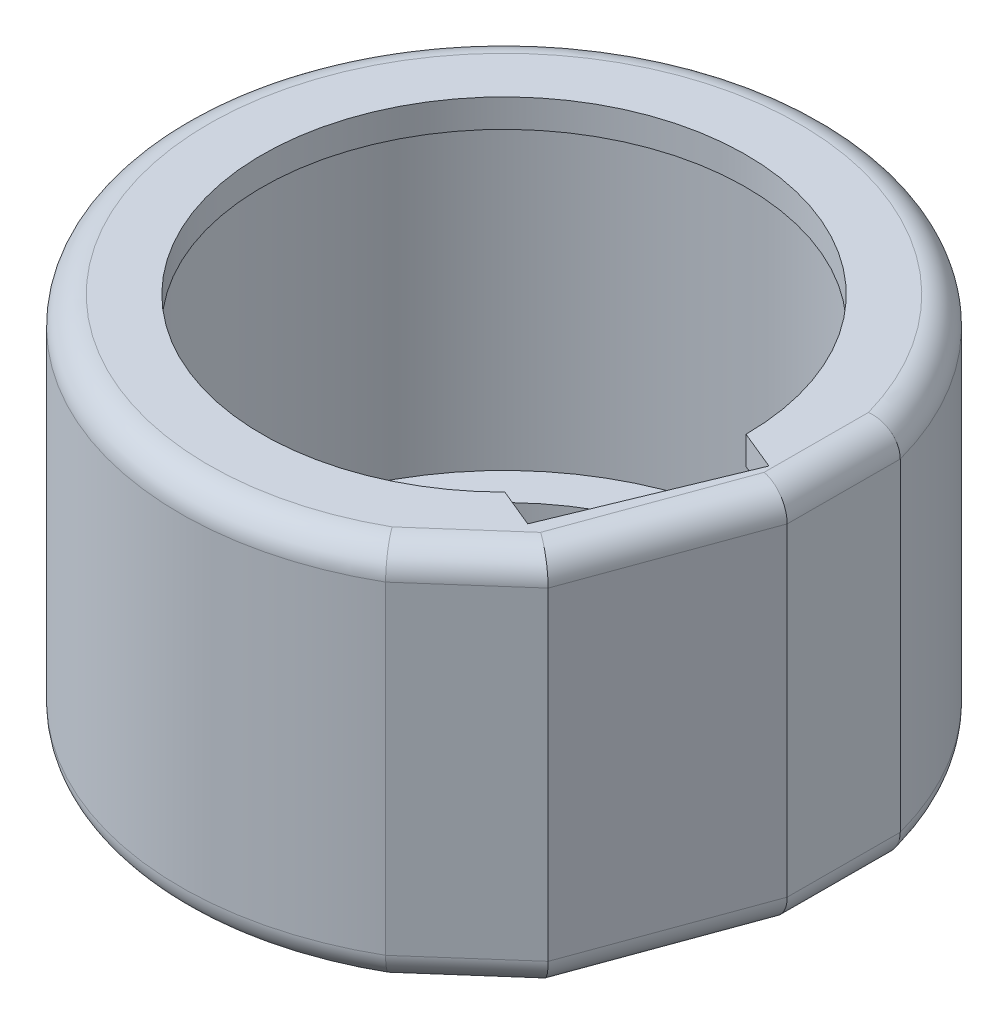
from build123d import *

# Parameters (mm, degrees)
EXTRUDE_1_DEPTH     = 1
EXTRUDE_START       = 11.5
EXTRUDE_3_DEPTH     = 11.5
EXTRUDE_START_2     = 1
EXTRUDE_4_DEPTH     = 1
FILLET_1_R          = 1
FILLET_2_R          = 1
CUT_EXTRUDE_1_DEPTH = 1.5
SKETCH2_R           = 0.8000000000000002
CUT_EXTRUDE1_DEPTH  = 10


with BuildPart() as part:
    # 草图1 → 凸台-拉伸1 (new body)
    with BuildSketch(Plane(origin=(0, 0, 0), x_dir=(1, 0, 0), z_dir=(0, 1, 0))):
        with BuildLine():
            Line((11.105707880639235, -1.030263157894738), (8.830971038533972, -7.261995457156121))
            Line((8.830971038533972, -7.261995457156121), (5.755000000000001, -9.96795239755889))
            ThreePointArc((5.755000000000001, -9.96795239755889), (-10.633853419204911, 4.404686306522179), (11.117806260587173, 2.9790072091300246))
            Line((11.117806260587173, 2.9790072091300246), (11.105707880639235, -1.030263157894738))
        make_face()
        with BuildLine():
            Line((8.61, 0), (6.102725069252079, -6.073618915368515))
            ThreePointArc((6.102725069252079, -6.073618915368515), (-7.958535130482882, 3.2853947368421053), (8.61, 0))
        make_face(mode=Mode.SUBTRACT)
    extrude(amount=EXTRUDE_1_DEPTH)

    # 草图2 → 凸台-拉伸3 (add)
    with BuildSketch(Plane(origin=(0, 0, 0), x_dir=(-1, 0, 0), z_dir=(0, -1, 0)).offset(EXTRUDE_START)):
        with BuildLine():
            Line((-11.105707880639235, -1.0302631578947385), (-11.117806260587194, 2.979007209129939))
            ThreePointArc((-11.117806260587194, 2.979007209129939), (10.633853419204895, 4.4046863065222155), (-5.755, -9.967952397558888))
            Line((-5.755, -9.967952397558888), (-8.830971038533972, -7.261995457156121))
            Line((-8.830971038533972, -7.261995457156121), (-11.105707880639235, -1.0302631578947385))
        make_face()
        with BuildLine():
            Line((-7.38872176822761, -6.753287394426469), (-9.999910578514989, -0.44931995471382746))
            ThreePointArc((-9.999910578514989, -0.44931995471382746), (9.248034120437978, 3.8306611579745526), (-7.38872176822761, -6.753287394426469))
        make_face(mode=Mode.SUBTRACT)
    extrude(amount=-EXTRUDE_3_DEPTH)

    # 草图5 → 凸台-拉伸4 (add)
    with BuildSketch(Plane(origin=(0, -11.5, 0), x_dir=(-1, 0, 0), z_dir=(0, -1, 0)).offset(EXTRUDE_START_2)):
        with BuildLine():
            Line((-11.117806260587196, 2.9790072091299398), (-11.105707880639235, -1.0302631578947385))
            Line((-11.105707880639235, -1.0302631578947385), (-8.830971038533972, -7.261995457156121))
            Line((-8.830971038533972, -7.261995457156121), (-5.75500000000001, -9.967952397558882))
            ThreePointArc((-5.75500000000001, -9.967952397558882), (10.633853419204897, 4.4046863065222155), (-11.117806260587196, 2.9790072091299398))
        make_face()
        with BuildLine():
            Line((-8.609999999999998, 4.3e-16), (-6.102725069252077, -6.073618915368515))
            ThreePointArc((-6.102725069252077, -6.073618915368515), (7.958535130482882, 3.2853947368421044), (-8.609999999999998, 4.3e-16))
        make_face(mode=Mode.SUBTRACT)
    extrude(amount=-EXTRUDE_4_DEPTH)

    # 圆角1
    # the kernel refuses this fillet: 1 mm, written as the material it takes off along each edge
    with BuildSketch(Plane(origin=(10.708026446892594, -12.5, 5.610734425716317), x_dir=(-0.6605044125759215, 0, -0.7508221633434492), z_dir=(-0.7508221633434492, 0, 0.6605044125759215))) as fillet_1_piece_1:
        with BuildLine():
            CenterArc((FILLET_1_R, -FILLET_1_R), FILLET_1_R, 90, 90)
            Line((-5.1e-16, -FILLET_1_R), (0, 0))
            Line((0, 0), (FILLET_1_R, 0))
        make_face()
    extrude(amount=9.096803728910329, mode=Mode.SUBTRACT)
    with BuildSketch(Plane(origin=(6.9e-16, -12.5, -2.44e-15), x_dir=(0.6755263906448474, 0, 0.7373358092093079), z_dir=(0.7373358092093079, 0, -0.6755263906448474))) as fillet_1_piece_2:
        with BuildLine():
            CenterArc((11.509999999999996 - FILLET_1_R, -FILLET_1_R), FILLET_1_R, 0, 90)
            Line((11.509999999999996 - FILLET_1_R, 0), (11.509999999999996, 0))
            Line((11.509999999999996, 0), (11.509999999999996, -FILLET_1_R))
        make_face()
    revolve(axis=Axis((6.9e-16, -12.5, -2.44e-15), (0, -1, 0)), revolution_arc=309.9900816208065, mode=Mode.SUBTRACT)
    with BuildSketch(Plane(origin=(11.1253502297869, -12.5, -5.47899582680977), x_dir=(0, 1, 0), z_dir=(-0.0030175876798964035, 0, 0.9999954470719326))) as fillet_1_piece_3:
        with BuildLine():
            CenterArc((FILLET_1_R, FILLET_1_R), FILLET_1_R, 180, 90)
            Line((0, FILLET_1_R), (0, 0))
            Line((0, 0), (FILLET_1_R, 0))
        make_face()
    extrude(amount=9.009288621027371, mode=Mode.SUBTRACT)
    with BuildSketch(Plane(origin=(11.962944744412491, -12.5, -1.3181714184535556), x_dir=(7e-17, 1, 3e-17), z_dir=(-0.34289474550930243, 0, 0.9393738305393177))) as fillet_1_piece_4:
        with BuildLine():
            CenterArc((FILLET_1_R, FILLET_1_R), FILLET_1_R, 180, 90)
            Line((-8e-17, FILLET_1_R), (0, 0))
            Line((0, 0), (FILLET_1_R, 0))
        make_face()
    extrude(amount=11.633921551427072, mode=Mode.SUBTRACT)

    # 圆角2
    # the kernel refuses this fillet: 1 mm, written as the material it takes off along each edge
    with BuildSketch(Plane(origin=(11.1253502297869, 1, -5.4789958268098555), x_dir=(0, -1, 0), z_dir=(-0.0030175876798905804, 0, 0.9999954470719326))) as fillet_2_piece_1:
        with BuildLine():
            CenterArc((FILLET_2_R, -FILLET_2_R), FILLET_2_R, 90, 90)
            Line((0, -FILLET_2_R), (0, 0))
            Line((0, 0), (FILLET_2_R, 0))
        make_face()
    extrude(amount=9.009288621027455, mode=Mode.SUBTRACT)
    with BuildSketch(Plane(origin=(9.9e-16, 1, -2.2e-16), x_dir=(0.6755263906448468, 0, 0.7373358092093085), z_dir=(0.7373358092093085, 0, -0.6755263906448468))) as fillet_2_piece_2:
        with BuildLine():
            CenterArc((11.51 - FILLET_2_R, FILLET_2_R), FILLET_2_R, 270, 90)
            Line((11.51 - FILLET_2_R, 0), (11.51, 0))
            Line((11.51, 0), (11.51, FILLET_2_R))
        make_face()
    revolve(axis=Axis((9.9e-16, 1, -2.2e-16), (0, -1, 0)), revolution_arc=309.99008162080594, mode=Mode.SUBTRACT)
    with BuildSketch(Plane(origin=(10.708026446892594, 1, 5.610734425716318), x_dir=(-0.6605044125759214, 0, -0.7508221633434493), z_dir=(-0.7508221633434492, 0, 0.6605044125759213))) as fillet_2_piece_3:
        with BuildLine():
            CenterArc((FILLET_2_R, FILLET_2_R), FILLET_2_R, 180, 90)
            Line((0, FILLET_2_R), (0, 0))
            Line((0, 0), (FILLET_2_R, 0))
        make_face()
    extrude(amount=9.096803728910338, mode=Mode.SUBTRACT)
    with BuildSketch(Plane(origin=(11.962944744412493, 1, -1.318171418453556), x_dir=(-0.9393738305393178, 0, -0.3428947455093024), z_dir=(-0.3428947455093024, 0, 0.9393738305393177))) as fillet_2_piece_4:
        with BuildLine():
            CenterArc((FILLET_2_R, FILLET_2_R), FILLET_2_R, 180, 90)
            Line((-6.1e-16, FILLET_2_R), (0, 0))
            Line((0, 0), (FILLET_2_R, 0))
        make_face()
    extrude(amount=11.633921551427074, mode=Mode.SUBTRACT)

    # 草图7 → 切除-拉伸1 (cut)
    with BuildSketch(Plane(origin=(7.3563625346260375, 0, 3.036809457684256), x_dir=(-0.3815789473684208, 0, 0.9243362520886044), z_dir=(-0.9243362520886044, 0, -0.3815789473684208))):
        Polygon((-3.2853947368421035, 0), (3.2853947368421053, 0), (3.2853947368421057, 1), (-3.2853947368421035, 1), align=None)
    extrude(amount=-CUT_EXTRUDE_1_DEPTH, mode=Mode.SUBTRACT)

    # Sketch2 → Cut-Extrude1 (cut)
    with BuildSketch(Plane(origin=(-10.79858227646779, 0, 3.9838073269619487), x_dir=(0.3461170570774934, 0, 0.938191335922484), z_dir=(-0.938191335922484, 0, 0.34611705707749346))):
        with Locations((0, -5.75)):
            Circle(SKETCH2_R)
    extrude(amount=-CUT_EXTRUDE1_DEPTH, mode=Mode.SUBTRACT)


solid = part.part
